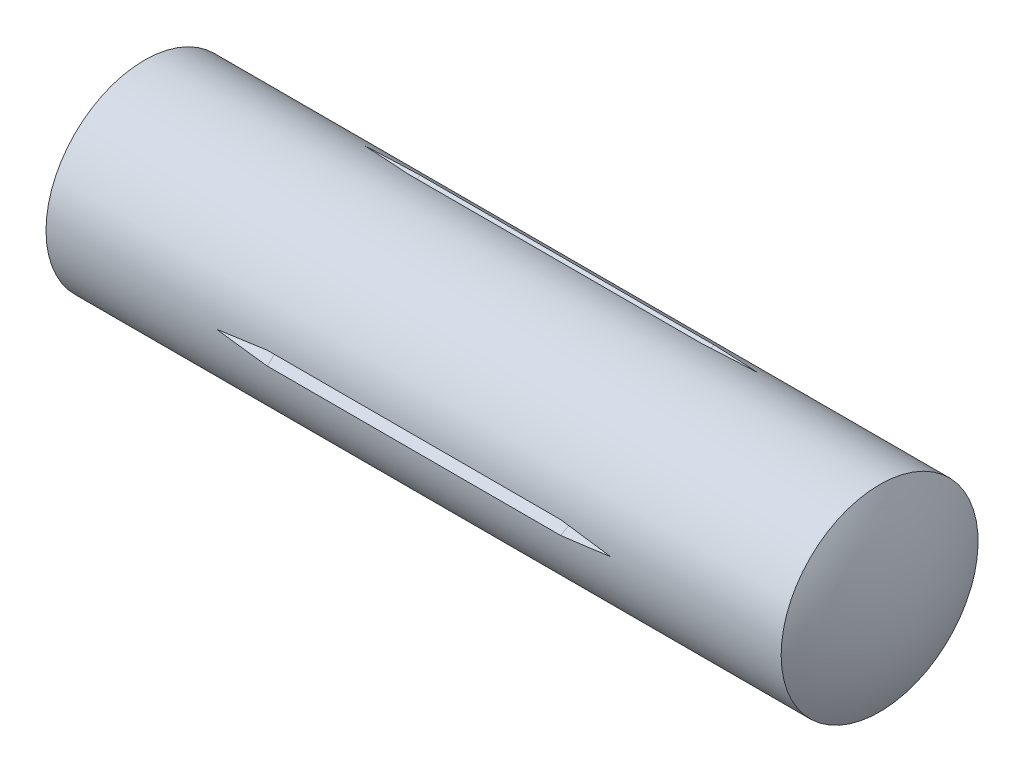
from build123d import *

# Parameters (mm, degrees)
CIRPATTERN2_COUNT = 3


with BuildPart() as part:
    # Sketch1 → Base-Revolve (revolve)
    with BuildSketch(Plane.XY):
        with BuildLine():
            Line((-50, 0), (-50, 1.25))
            ThreePointArc((-50, 1.25), (-49.010050505, 7.072345027), (-46.68190465, 12.5))
            Line((-46.68190465, 12.5), (46.650635095, 12.5))
            ThreePointArc((46.650635095, 12.5), (49.148145657, 6.470476128), (50, 0))
            Line((50, 0), (-50, 0))
        make_face()
    revolve(axis=Axis((-57, 0, 0), (1, 0, 0)))

    # Cut-Sweep3: sweep along a path in Sketch3
    with BuildLine(Plane(origin=(0, 0, 0), x_dir=(1, 0, 0), z_dir=(0, 1, 0))) as cut_sweep3_path:
        Line((-25, -12.5), (-18.75, -11.25))
        Line((-18.75, -11.25), (18.75, -11.25))
        Line((18.75, -11.25), (25, -12.5))
    # Sketch4 → Cut-Sweep3 (sweep, cut)
    with BuildSketch(Plane(origin=(-25, 0, 0), x_dir=(0, 0, -1), z_dir=(1, 0, 0))):
        Polygon((-12.5, 0), (-14.378358908, 1.315241067), (-14.378358908, -1.315241067), align=None)
    cut_sweep3 = sweep(path=cut_sweep3_path.line, transition=Transition.RIGHT, mode=Mode.SUBTRACT)

    # CirPattern2: Cut-Sweep3 ×3 about axis
    cirpattern2_axis = Axis((-57, 0, 0), (1, 0, 0))
    for i in range(1, CIRPATTERN2_COUNT):
        add(cut_sweep3.rotate(cirpattern2_axis, i * 360 / CIRPATTERN2_COUNT), mode=Mode.SUBTRACT)


solid = part.part
